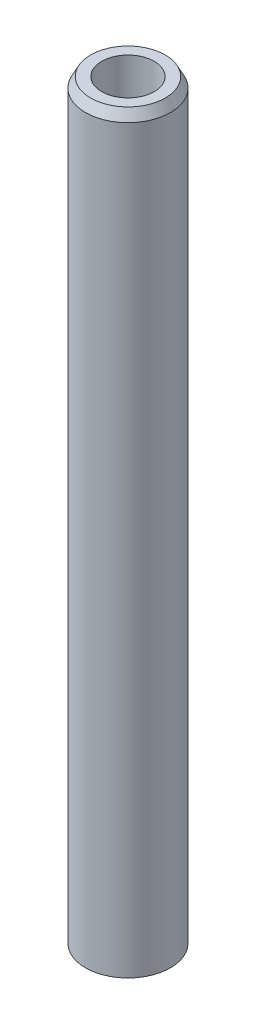
from build123d import *
from OCP.BRepFilletAPI import BRepFilletAPI_MakeChamfer

# Parameters (mm, degrees)
SKETCH1_R           = 10
BOSS_EXTRUDE1_DEPTH = 177.874236027
SKETCH2_R           = 6.186509407
CUT_EXTRUDE1_DEPTH  = 179.435545344
CHAMFER1_SIZE       = 2.351708726
CHAMFER1_SIZE2      = 1.215338814


with BuildPart() as part:
    # Sketch1 → Boss-Extrude1 (new body)
    with BuildSketch(Plane(origin=(0, 0, 0), x_dir=(1, 0, 0), z_dir=(0, 1, 0))):
        Circle(SKETCH1_R)
    extrude(amount=BOSS_EXTRUDE1_DEPTH)

    # Sketch2 → Cut-Extrude1 (cut, through all)
    with BuildSketch(Plane(origin=(0, 0, 0), x_dir=(1, 0, 0), z_dir=(0, 1, 0))):
        Circle(SKETCH2_R)
    extrude(amount=CUT_EXTRUDE1_DEPTH, mode=Mode.SUBTRACT)

    # Chamfer1: one chamfer whose edges measure the first distance from different faces: ONE call of the kernel's chamfer builder (chamfer() names one face for all edges)
    chamfer1_edges_1 = [part.edges().sort_by_distance(p)[0] for p in [
        (-10, 177.874236027, 0),
    ]]
    chamfer1_side_1 = [part.faces().sort_by_distance(p)[0] for p in [
        (-10, 88.937118014, 0),
    ]]
    chamfer1_edges_2 = [part.edges().sort_by_distance(p)[0] for p in [
        (-10, 0, 0),
    ]]
    chamfer1_side_2 = [part.faces().sort_by_distance(p)[0] for p in [
        (-9.717157288, 0, 0),
    ]]
    chamfer1 = BRepFilletAPI_MakeChamfer(part.part.solid().wrapped)
    for e in chamfer1_edges_1:
        chamfer1.Add(CHAMFER1_SIZE, CHAMFER1_SIZE2, e.wrapped, chamfer1_side_1[0].wrapped)  # the first distance lies on this face
    for e in chamfer1_edges_2:
        chamfer1.Add(CHAMFER1_SIZE, CHAMFER1_SIZE2, e.wrapped, chamfer1_side_2[0].wrapped)  # the first distance lies on this face
    add(Compound.cast(chamfer1.Shape()), mode=Mode.REPLACE)


solid = part.part
